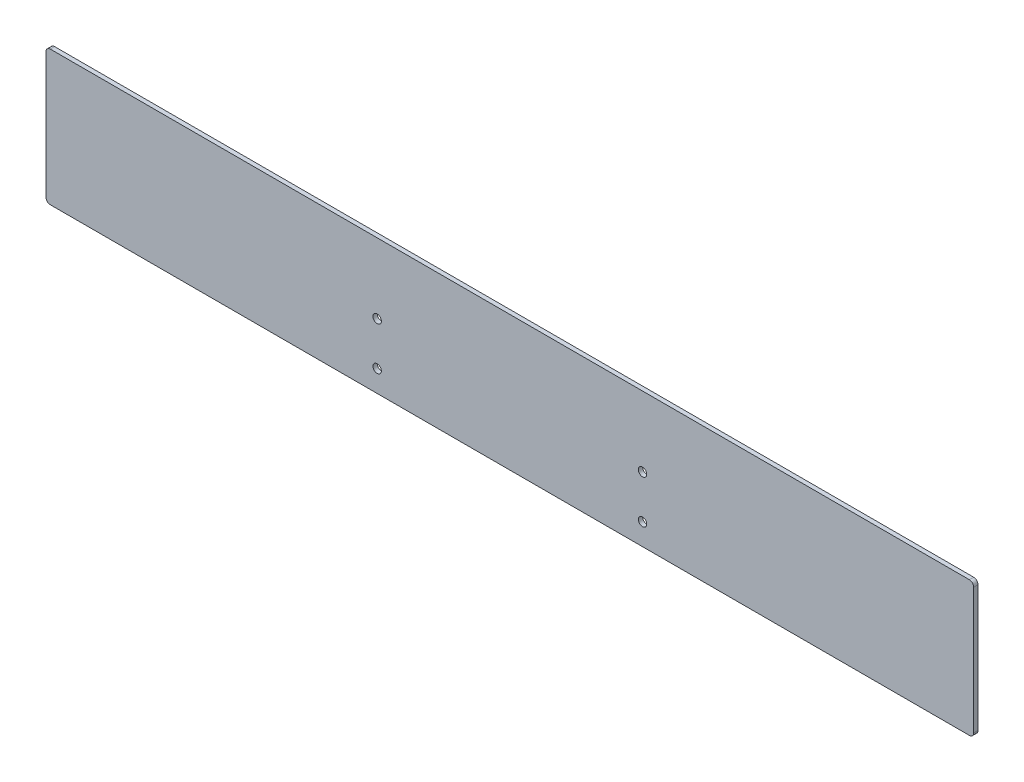
from build123d import *

# Parameters (mm, degrees)
SKETCH1_W           = 430
SKETCH1_H           = 62.5
SKETCH1_R           = 1.95
BOSS_EXTRUDE1_DEPTH = 2
FILLET1_R           = 2


with BuildPart() as part:
    # Sketch1 → Boss-Extrude1 (new body)
    with BuildSketch(Plane.XY):
        with Locations((-141.905896291, -13.046482412)):
            Rectangle(SKETCH1_W, SKETCH1_H)
        with Locations((-80.405896291, -14.296482412)):
            Circle(SKETCH1_R, mode=Mode.SUBTRACT)
        with Locations((-80.405896291, -34.296482412)):
            Circle(SKETCH1_R, mode=Mode.SUBTRACT)
        with Locations((-203.405896291, -14.296482412)):
            Circle(SKETCH1_R, mode=Mode.SUBTRACT)
        with Locations((-203.405896291, -34.296482412)):
            Circle(SKETCH1_R, mode=Mode.SUBTRACT)
    extrude(amount=BOSS_EXTRUDE1_DEPTH)

    # Fillet1
    fillet1_edges = [part.edges().sort_by_distance(p)[0] for p in [
        (73.094103709, 18.203517588, 1),
        (73.094103709, -44.296482412, 1),
        (-356.905896291, -44.296482412, 1),
        (-356.905896291, 18.203517588, 1),
    ]]
    fillet(fillet1_edges, radius=FILLET1_R)


solid = part.part
